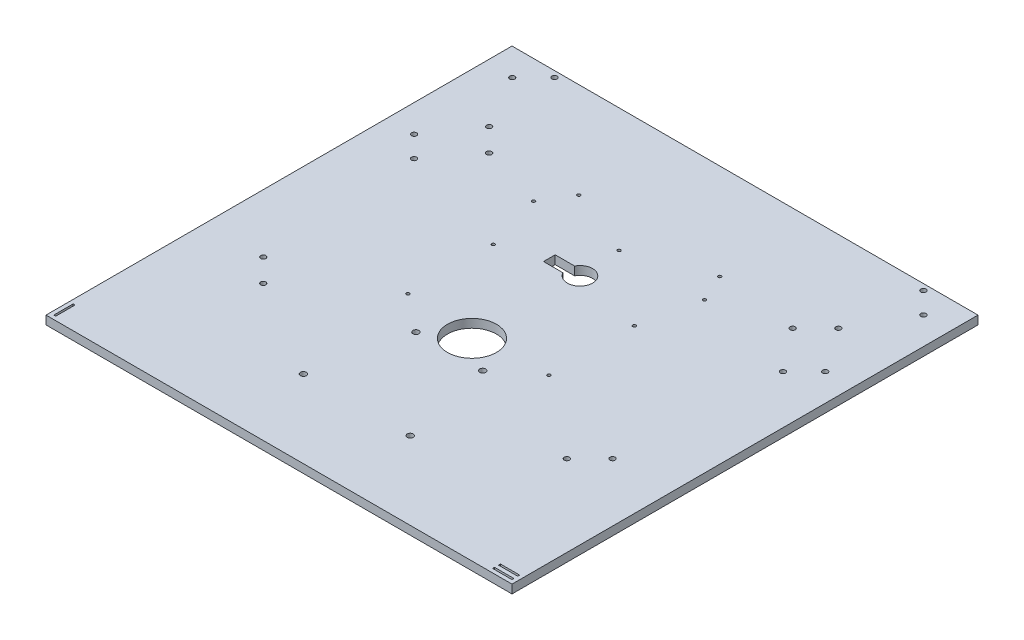
from build123d import *

# Parameters (mm, degrees)
SKETCH2_W           = 304.8
SKETCH2_H           = 304.8
BOSS_EXTRUDE1_DEPTH = 5.588
SKETCH4_W           = 1.27
SKETCH4_H           = 12.7
SKETCH4_W_2         = 12.7
SKETCH4_H_2         = 1.27
CUT_EXTRUDE1_DEPTH  = 432.088512656
SKETCH5_W           = 228.854
SKETCH5_H           = 12.954
CUT_EXTRUDE2_DEPTH  = 0.254
SKETCH6_R           = 16.002
SKETCH6_R_2         = 1.7
SKETCH6_R_3         = 1.96
CUT_EXTRUDE3_DEPTH  = 432.088512656
CUT_EXTRUDE4_DEPTH  = 432.088512656
SKETCH8_R           = 1.016
CUT_EXTRUDE5_DEPTH  = 432.088512656
SKETCH9_R           = 1.016
CUT_EXTRUDE6_DEPTH  = 432.088512656
BOSS_EXTRUDE3_REACH = 433.089
SKETCH10_W          = 236.011664121
SKETCH10_H          = 22.945578457


with BuildPart() as part:
    # Sketch2 → Boss-Extrude1 (new body)
    with BuildSketch(Plane(origin=(0, 0, 0), x_dir=(1, 0, 0), z_dir=(0, 1, 0))):
        with Locations((152.4, 152.4)):
            Rectangle(SKETCH2_W, SKETCH2_H)
    extrude(amount=BOSS_EXTRUDE1_DEPTH)

    # Sketch4 → Cut-Extrude1 (cut, through all)
    with BuildSketch(Plane(origin=(0, 5.588, 0), x_dir=(1, 0, 0), z_dir=(0, 1, 0))):
        with Locations((3.175, 8.89)):
            Rectangle(SKETCH4_W, SKETCH4_H)
        with Locations((295.91, 3.175)):
            Rectangle(SKETCH4_W_2, SKETCH4_H_2)
        with Locations((295.91, 6.985)):
            Rectangle(SKETCH4_W_2, SKETCH4_H_2)
    extrude(amount=-CUT_EXTRUDE1_DEPTH, mode=Mode.SUBTRACT)

    # Sketch5 → Cut-Extrude2 (cut)
    with BuildSketch(Plane(origin=(0, 5.588, 0), x_dir=(1, 0, 0), z_dir=(0, 1, 0))):
        with Locations((148.97354, 274.58924)):
            Rectangle(SKETCH5_W, SKETCH5_H)
    extrude(amount=-CUT_EXTRUDE2_DEPTH, mode=Mode.SUBTRACT)

    # Sketch6 → Cut-Extrude3 (cut, through all)
    with BuildSketch(Plane(origin=(0, 5.588, 0), x_dir=(1, 0, 0), z_dir=(0, 1, 0))):
        with Locations((152.4799846, 126.1262654)):
            Circle(SKETCH6_R)
        with Locations((31.75, 300.832130008)):
            Circle(SKETCH6_R_2)
        with Locations((17.93875, 287.020880008)):
            Circle(SKETCH6_R_2)
        with Locations((273.05, 300.832130008)):
            Circle(SKETCH6_R_2)
        with Locations((286.86125, 287.020880008)):
            Circle(SKETCH6_R_2)
        with Locations((286.86125, 222.781740008)):
            Circle(SKETCH6_R_2)
        with Locations((273.05, 208.970490008)):
            Circle(SKETCH6_R_2)
        with Locations((31.75, 208.970490008)):
            Circle(SKETCH6_R_2)
        with Locations((17.93875, 222.781740008)):
            Circle(SKETCH6_R_2)
        with Locations((38.1787654, 103.9330154)):
            Circle(SKETCH6_R_2)
        with Locations((53.1330154, 88.9787654)):
            Circle(SKETCH6_R_2)
        with Locations((251.6669846, 88.9787654)):
            Circle(SKETCH6_R_2)
        with Locations((266.6212346, 103.9330154)):
            Circle(SKETCH6_R_2)
        with Locations((266.6212346, 251.6669846)):
            Circle(SKETCH6_R_2)
        with Locations((251.6669846, 236.7127346)):
            Circle(SKETCH6_R_2)
        with Locations((53.1330154, 236.7127346)):
            Circle(SKETCH6_R_2)
        with Locations((38.1787654, 251.6669846)):
            Circle(SKETCH6_R_2)
        with Locations((130.6518596, 111.328047494)):
            Circle(SKETCH6_R_3)
        with Locations((174.3081096, 111.328047494)):
            Circle(SKETCH6_R_3)
        with Locations((187.4049846, 50.821596477)):
            Circle(SKETCH6_R_3)
        with Locations((117.5549846, 50.821596477)):
            Circle(SKETCH6_R_3)
    extrude(amount=-CUT_EXTRUDE3_DEPTH, mode=Mode.SUBTRACT)

    # Sketch7 → Cut-Extrude4 (cut, through all)
    with BuildSketch(Plane(origin=(0, 5.588, 0), x_dir=(1, 0, 0), z_dir=(0, 1, 0))):
        with BuildLine():
            Line((145.076822752, 200.66), (132.376822752, 200.66))
            Line((132.376822752, 200.66), (132.376822752, 193.04))
            Line((132.376822752, 193.04), (145.076822752, 193.04))
            ThreePointArc((145.076822752, 193.04), (160.655, 196.85), (145.076822752, 200.66))
        make_face()
    extrude(amount=-CUT_EXTRUDE4_DEPTH, mode=Mode.SUBTRACT)

    # Sketch8 → Cut-Extrude5 (cut, through all)
    with BuildSketch(Plane(origin=(0, 5.588, 0), x_dir=(1, 0, 0), z_dir=(0, 1, 0))):
        with Locations((206.6999846, 223.9950154)):
            Circle(SKETCH8_R)
        with Locations((150.8199846, 223.9950154)):
            Circle(SKETCH8_R)
        with Locations((94.9399846, 223.9950154)):
            Circle(SKETCH8_R)
    extrude(amount=-CUT_EXTRUDE5_DEPTH, mode=Mode.SUBTRACT)

    # Sketch9 → Cut-Extrude6 (cut, through all)
    with BuildSketch(Plane(origin=(0, 5.588, 0), x_dir=(1, 0, 0), z_dir=(0, 1, 0))):
        with Locations((106.3, 242.18)):
            Circle(SKETCH9_R)
        with Locations((106.3, 186.3)):
            Circle(SKETCH9_R)
        with Locations((106.3, 130.42)):
            Circle(SKETCH9_R)
        with Locations((198.5, 130.42)):
            Circle(SKETCH9_R)
        with Locations((198.5, 186.3)):
            Circle(SKETCH9_R)
        with Locations((198.5, 242.18)):
            Circle(SKETCH9_R)
    extrude(amount=-CUT_EXTRUDE6_DEPTH, mode=Mode.SUBTRACT)

    # Sketch10 → Boss-Extrude3 (add, up to next)
    with BuildSketch(Plane(origin=(0, 5.588, 0), x_dir=(1, 0, 0), z_dir=(0, 1, 0)), mode=Mode.PRIVATE) as boss_extrude3_sk1:
        with Locations((148.069627159, 275.695978824)):
            Rectangle(SKETCH10_W, SKETCH10_H)
    boss_extrude3_tool1 = extrude(boss_extrude3_sk1.sketch, amount=-BOSS_EXTRUDE3_REACH, mode=Mode.PRIVATE) - part.part
    add(boss_extrude3_tool1.solids().sort_by_distance((148.069627, 5.588, -275.695979))[0])


solid = part.part
